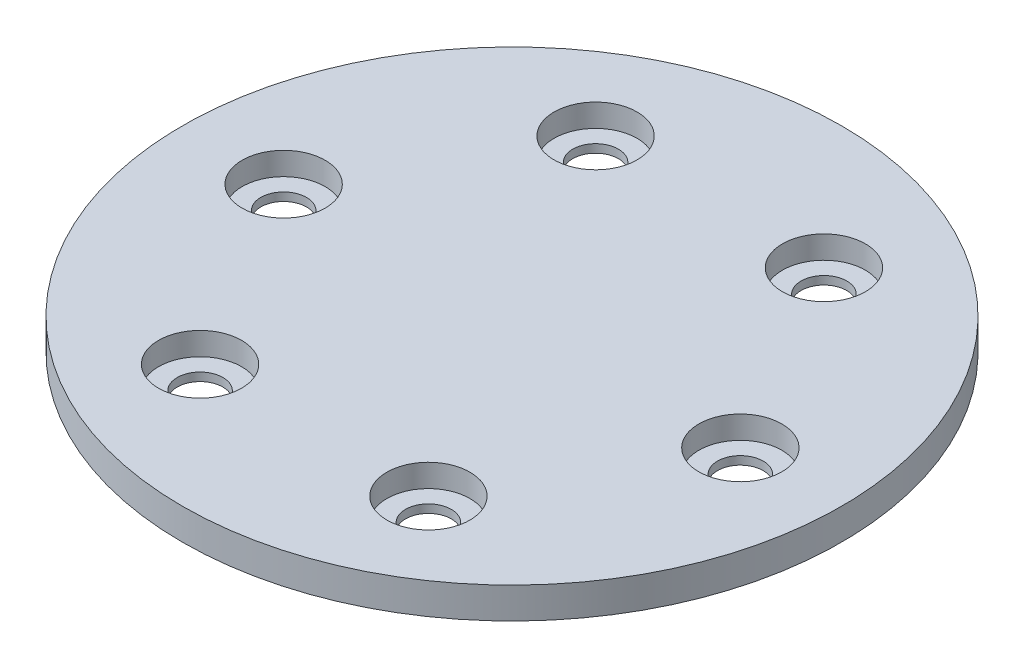
from build123d import *

# Parameters (mm, degrees)
SKETCH1_R           = 15.875
BOSS_EXTRUDE1_DEPTH = 1.5
CIRPATTERN1_COUNT   = 6


with BuildPart() as part:
    # Sketch1 → Boss-Extrude1 (new body)
    with BuildSketch(Plane(origin=(0, 0, 0), x_dir=(1, 0, 0), z_dir=(0, 1, 0))):
        Circle(SKETCH1_R)
    extrude(amount=BOSS_EXTRUDE1_DEPTH)

    # Sketch14 → CBORE for M5 Hex Head Bolt1 (revolve, cut)
    with BuildSketch(Plane(origin=(-11, 1.5, 0), x_dir=(0, 0, 1), z_dir=(1, 0, 0))):
        Polygon((0, 0), (0, 5.660946681), (1.1, 5), (1.1, 1.1), (2, 1.1), (2, 0), align=None)
    cbore_for_m5_hex_head_bolt1 = revolve(axis=Axis((-11, 7.85, 0), (0, -1, 0)), mode=Mode.SUBTRACT)

    # CirPattern1: CBORE for M5 Hex Head Bolt1 ×6 about axis
    cirpattern1_axis = Axis((0, 1.5, 0), (0, 1, 0))
    for i in range(1, CIRPATTERN1_COUNT):
        add(cbore_for_m5_hex_head_bolt1.rotate(cirpattern1_axis, i * 360 / CIRPATTERN1_COUNT), mode=Mode.SUBTRACT)


solid = part.part
